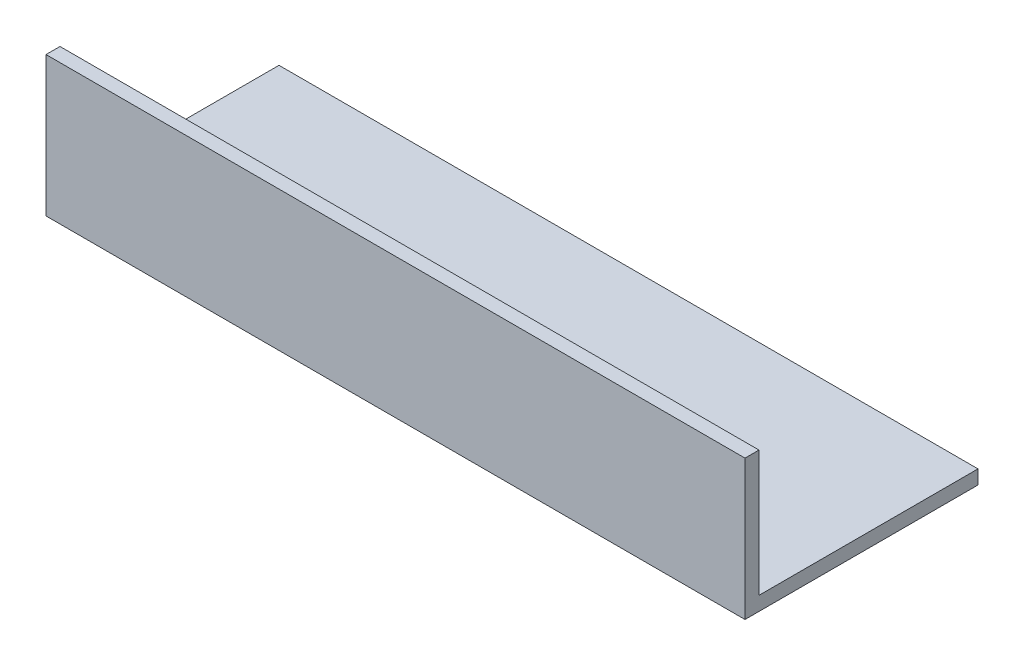
from build123d import *

# Parameters (mm, degrees)
EXTRUDE_1_DEPTH = 150


with BuildPart() as part:
    # Эскиз1 → Вытянуть-Тонкостенный1 (new body)
    with BuildSketch(Plane(origin=(0, 0, 0), x_dir=(0, 0, -1), z_dir=(1, 0, 0))):
        Polygon((50, 0), (0, 0), (0, 30), (3, 30), (3, 3), (50, 3), align=None)
    extrude(amount=EXTRUDE_1_DEPTH)


solid = part.part
